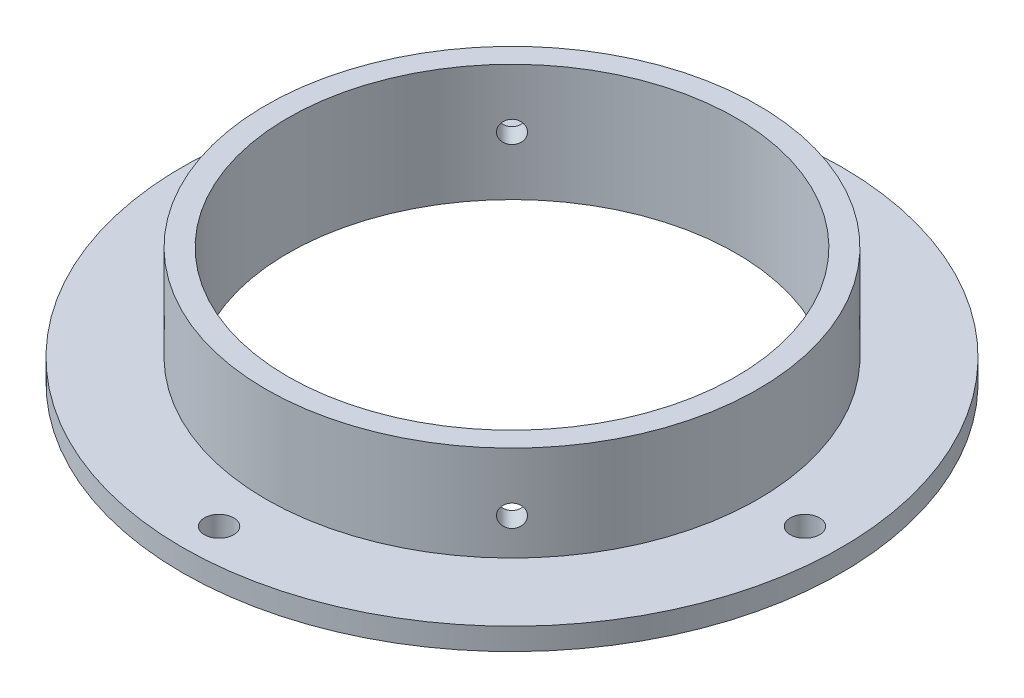
from build123d import *

# Parameters (mm, degrees)
SKETCH3_R          = 2
CUT_EXTRUDE1_DEPTH = 65.953829756
SKETCH5_R          = 1.5
CUT_EXTRUDE2_DEPTH = 66.620118866
CIRPATTERN1_COUNT  = 4


with BuildPart() as part:
    # Sketch2 → Revolve1 (revolve)
    with BuildSketch(Plane.XY):
        Polygon((30.6, 16), (30.6, 0), (45, 0), (45, 3), (33.6, 3), (33.6, 16), align=None)
    revolve(axis=Axis((0, 31.868523677, 0), (0, -1, 0)))

    # Sketch3 → Cut-Extrude1 (cut, through all)
    with BuildSketch(Plane(origin=(0, 3, 0), x_dir=(1, 0, 0), z_dir=(0, 1, 0))):
        with Locations((0, 40)):
            Circle(SKETCH3_R)
        with Locations((40, 0)):
            Circle(SKETCH3_R)
        with Locations((0, -40)):
            Circle(SKETCH3_R)
        with Locations((-40, 0)):
            Circle(SKETCH3_R)
    extrude(amount=-CUT_EXTRUDE1_DEPTH, mode=Mode.SUBTRACT)

    # Sketch5 → Cut-Extrude2 (cut, through all)
    with BuildSketch(Plane(origin=(0, 0, 0), x_dir=(0, 1, 0), z_dir=(0.7071067811865488, 0, 0.7071067811865464))):
        with Locations((8, 0)):
            Circle(SKETCH5_R)
    cut_extrude2 = extrude(amount=-CUT_EXTRUDE2_DEPTH, mode=Mode.SUBTRACT)

    # CirPattern1: Cut-Extrude2 ×4 about axis
    cirpattern1_axis = Axis((0, 31.868523677, 0), (0, 1, 0))
    for i in range(1, CIRPATTERN1_COUNT):
        add(cut_extrude2.rotate(cirpattern1_axis, i * 360 / CIRPATTERN1_COUNT), mode=Mode.SUBTRACT)


solid = part.part
